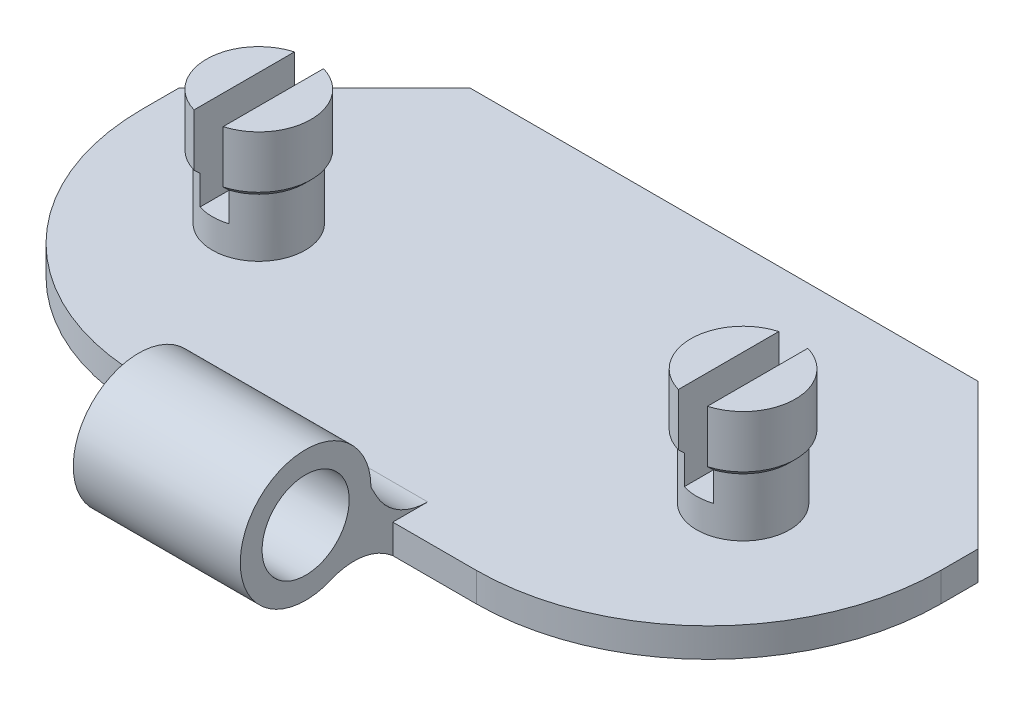
from build123d import *

# Parameters (mm, degrees)
SKETCH2_W               = 55
SKETCH2_H               = 38
BOSS_EXTRUDE1_DEPTH     = 2
SKETCH3_R               = 3.2
BOSS_EXTRUDE2_DEPTH     = 10
SKETCH4_R               = 3.6
BOSS_EXTRUDE3_DEPTH     = 1
CHAMFER1_SIZE           = 3
SKETCH5_W               = 2
SKETCH5_H               = 10.684354826
CUT_EXTRUDE1_DEPTH      = 6
CHAMFER2_SIZE           = 10
CUT_EXTRUDE2_DEPTH      = 35.889110049
CUT_EXTRUDE2_DEPTH_BACK = 35.889110049
SKETCH8_W               = 9.45
SKETCH8_H               = 2
SKETCH9_R               = 3
BOSS_EXTRUDE4_DEPTH     = 5.75
FILLET1_R               = 4
FILLET2_R               = 16


with BuildPart() as part:
    # Sketch2 → Boss-Extrude1 (new body)
    with BuildSketch(Plane(origin=(0, 0, 0), x_dir=(1, 0, 0), z_dir=(0, 1, 0))):
        Rectangle(SKETCH2_W, SKETCH2_H)
    extrude(amount=BOSS_EXTRUDE1_DEPTH)

    # Sketch3 → Boss-Extrude2 (add)
    with BuildSketch(Plane(origin=(0, 0, 0), x_dir=(1, 0, 0), z_dir=(0, 1, 0))):
        with Locations(Location((-16.675, 3.65, 0), (0, 0, 270))):
            Circle(SKETCH3_R)
        with Locations(Location((16.675, 3.65, 0), (0, 0, 90))):
            Circle(SKETCH3_R)
    extrude(amount=BOSS_EXTRUDE2_DEPTH)

    # Sketch4 → Boss-Extrude3 (add)
    with BuildSketch(Plane(origin=(0, 10, 0), x_dir=(1, 0, 0), z_dir=(0, 1, 0))):
        with Locations(Location((-16.675, 3.65, 0), (0, 0, 270))):
            Circle(SKETCH4_R)
        with Locations(Location((16.675, 3.65, 0), (0, 0, 90))):
            Circle(SKETCH4_R)
    extrude(amount=-BOSS_EXTRUDE3_DEPTH)

    # Chamfer1
    # the kernel refuses this chamfer: 3 mm, written as the material it adds along each edge
    with BuildSketch(Plane(origin=(16.675, 9, -3.65), x_dir=(0, 0, -1), z_dir=(-1, 0, 0))) as chamfer1_piece_1_section:
        Polygon((3.2, CHAMFER1_SIZE), (3.2 + CHAMFER1_SIZE, 0), (3.2, 0), align=None)
    chamfer1_piece_1 = revolve(axis=Axis((16.675, 9, -3.65), (0, -1, 0)), mode=Mode.PRIVATE)
    chamfer1_piece_1 = chamfer1_piece_1 & Plane(origin=(16.675, 6.179265151, -3.65), x_dir=(0, 0, -1), z_dir=(0, 1, 0)) * Cylinder(3.6, 25, mode=Mode.PRIVATE)
    add(chamfer1_piece_1)
    with BuildSketch(Plane(origin=(-16.675, 9, -3.65), x_dir=(0, 0, 1), z_dir=(1, 0, 0))) as chamfer1_piece_2_section:
        Polygon((3.2, CHAMFER1_SIZE), (3.2 + CHAMFER1_SIZE, 0), (3.2, 0), align=None)
    chamfer1_piece_2 = revolve(axis=Axis((-16.675, 9, -3.65), (0, -1, 0)), mode=Mode.PRIVATE)
    chamfer1_piece_2 = chamfer1_piece_2 & Plane(origin=(-16.675, 6.179265151, -3.65), x_dir=(0, 0, 1), z_dir=(0, 1, 0)) * Cylinder(3.6, 25, mode=Mode.PRIVATE)
    add(chamfer1_piece_2)

    # Sketch5 → Cut-Extrude1 (cut)
    with BuildSketch(Plane(origin=(0, 10, 0), x_dir=(1, 0, 0), z_dir=(0, 1, 0))):
        with Locations((16.675, 3.65)):
            Rectangle(SKETCH5_W, SKETCH5_H)
        with Locations((-16.675, 3.65)):
            Rectangle(SKETCH5_W, SKETCH5_H)
    extrude(amount=-CUT_EXTRUDE1_DEPTH, mode=Mode.SUBTRACT)

    # Chamfer2
    chamfer2_edges = [part.edges().sort_by_distance(p)[0] for p in [
        (-27.5, 1, -19),
        (27.5, 1, -19),
    ]]
    chamfer(chamfer2_edges, length=CHAMFER2_SIZE)

    # Sketch8 → Cut-Extrude2 (cut, two sides: drawn at the far end of the back side and taken through both)
    with BuildSketch(Plane.ZY.offset(-CUT_EXTRUDE2_DEPTH_BACK)):
        with Locations((14.275, 1)):
            Rectangle(SKETCH8_W, SKETCH8_H)
    extrude(amount=CUT_EXTRUDE2_DEPTH + CUT_EXTRUDE2_DEPTH_BACK, mode=Mode.SUBTRACT)

    # Sketch9 → Boss-Extrude4 (add, symmetric)
    with BuildSketch(Plane.ZY):
        with BuildLine():
            Line((9.55, 2), (11.05, 4.828427125))
            ThreePointArc((11.05, 4.828427125), (19.792640687, 6.328427125), (12.05, 2))
            Line((12.05, 2), (9.55, 0))
            Line((9.55, 0), (9.55, 2))
        make_face()
        with Locations((15.55, 4.828427125)):
            Circle(SKETCH9_R, mode=Mode.SUBTRACT)
    extrude(amount=BOSS_EXTRUDE4_DEPTH, both=True)

    # Fillet1
    fillet1_edges = [part.edges().sort_by_distance(p)[0] for p in [
        (0, 2, 9.55),
        (0, 2, 12.05),
    ]]
    fillet(fillet1_edges, radius=FILLET1_R)

    # Fillet2
    fillet2_edges = [part.edges().sort_by_distance(p)[0] for p in [
        (27.5, 1, 9.55),
        (-27.5, 1, 9.55),
    ]]
    fillet(fillet2_edges, radius=FILLET2_R)


solid = part.part
